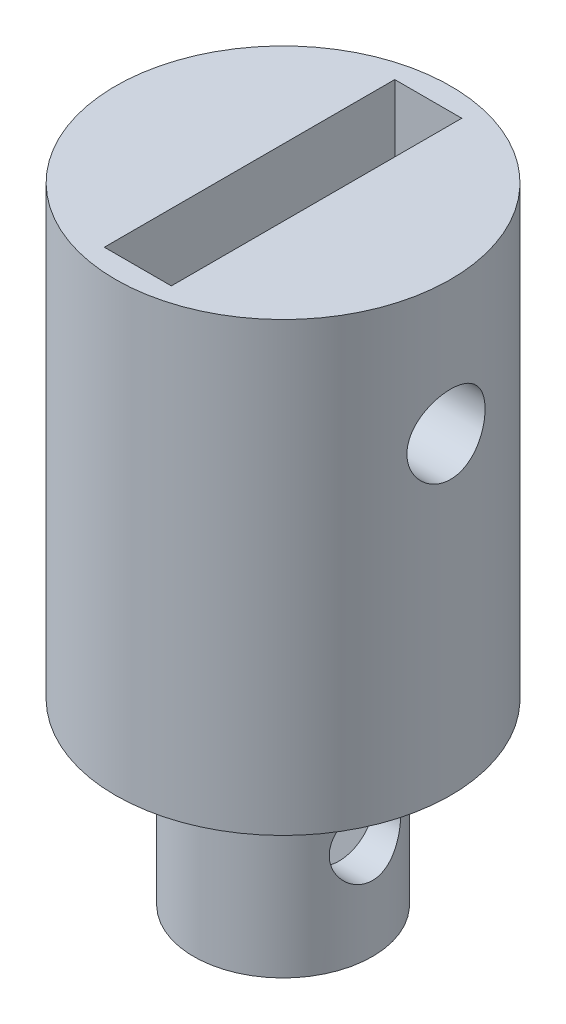
from build123d import *

# Parameters (mm, degrees)
SKETCH1_R           = 7.5
BOSS_EXTRUDE1_DEPTH = 20
SKETCH2_W           = 3
SKETCH2_H           = 13
CUT_EXTRUDE1_DEPTH  = 10
SKETCH3_R           = 1.75
CUT_EXTRUDE2_DEPTH  = 27.100766272
SKETCH4_R           = 4
BOSS_EXTRUDE2_DEPTH = 8
SKETCH5_W           = 5
SKETCH5_H           = 5
CUT_EXTRUDE3_DEPTH  = 6.2
SKETCH6_R           = 1.6
CUT_EXTRUDE4_DEPTH  = 27.100766435


with BuildPart() as part:
    # Sketch1 → Boss-Extrude1 (new body)
    with BuildSketch(Plane(origin=(0, 0, 0), x_dir=(1, 0, 0), z_dir=(0, 1, 0))):
        Circle(SKETCH1_R)
    extrude(amount=BOSS_EXTRUDE1_DEPTH)

    # Sketch2 → Cut-Extrude1 (cut)
    with BuildSketch(Plane(origin=(0, 20, 0), x_dir=(1, 0, 0), z_dir=(0, 1, 0))):
        Rectangle(SKETCH2_W, SKETCH2_H)
    extrude(amount=-CUT_EXTRUDE1_DEPTH, mode=Mode.SUBTRACT)

    # Sketch3 → Cut-Extrude2 (cut, through all)
    with BuildSketch(Plane(origin=(7.5, 0, 0), x_dir=(0, 0, -1), z_dir=(1, 0, 0))):
        with Locations((0, 14)):
            Circle(SKETCH3_R)
    extrude(amount=-CUT_EXTRUDE2_DEPTH, mode=Mode.SUBTRACT)

    # Sketch4 → Boss-Extrude2 (add)
    with BuildSketch(Plane.XZ):
        Circle(SKETCH4_R)
    extrude(amount=BOSS_EXTRUDE2_DEPTH)

    # Sketch5 → Cut-Extrude3 (cut)
    with BuildSketch(Plane.XZ.offset(8)):
        Rectangle(SKETCH5_W, SKETCH5_H)
    extrude(amount=-CUT_EXTRUDE3_DEPTH, mode=Mode.SUBTRACT)

    # Sketch6 → Cut-Extrude4 (cut, through all)
    with BuildSketch(Plane(origin=(7.5, 0, 0), x_dir=(0, 0, -1), z_dir=(1, 0, 0))):
        with Locations((0, -3.45)):
            Circle(SKETCH6_R)
    extrude(amount=-CUT_EXTRUDE4_DEPTH, mode=Mode.SUBTRACT)


solid = part.part
